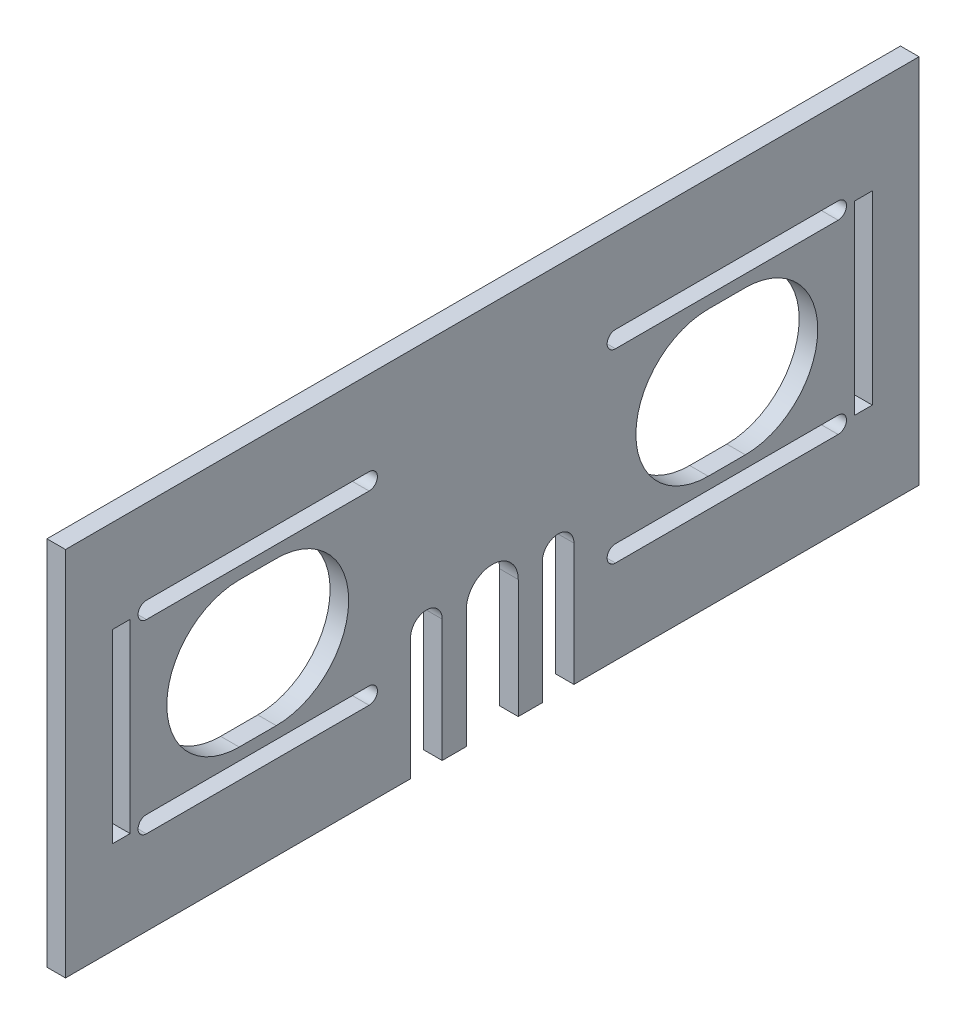
from build123d import *

# Parameters (mm, degrees)
CUT_EXTRUDE1_START     = -5
CUT_EXTRUDE1_OUTLINE_W = 4.8
CUT_EXTRUDE1_OUTLINE_H = 50
CUT_EXTRUDE1_DEPTH     = 5
BOSS_EXTRUDE1_START    = -5
BOSS_EXTRUDE1_DEPTH    = 5
BOSS_EXTRUDE2_START    = -5
BOSS_EXTRUDE2_DEPTH    = 5
CUT_EXTRUDE2_DEPTH     = 10
BOSS_EXTRUDE3_START    = -5
BOSS_EXTRUDE3_DEPTH    = 5
BOSS_EXTRUDE4_START    = -5
BOSS_EXTRUDE4_DEPTH    = 5


with BuildPart() as part:
    # Cut-Extrude1: read off the stored shape, not the designer's step
    # Cut-Extrude1 outline → Cut-Extrude1 (new body)
    with BuildSketch(Plane.ZY.offset(CUT_EXTRUDE1_START)):
        with BuildLine():
            Line((22, -25), (47, -50))
            Line((47, -50), (115, -50))
            Line((115, -50), (115, 50))
            Line((115, 50), (-115, 50))
            Line((-115, 50), (-115, -50))
            Line((-115, -50), (-47, -50))
            Line((-47, -50), (-22, -25))
            Line((-22, -25), (-22, 0))
            ThreePointArc((-22, 0), (-16.382917933, 14.683323874), (-2.4, 21.868699093))
            Line((-2.4, 21.868699093), (-2.4, 25))
            Line((-2.4, 25), (2.4, 25))
            Line((2.4, 25), (2.4, 21.868699093))
            ThreePointArc((2.4, 21.868699093), (16.382917933, 14.683323874), (22, 0))
            Line((22, 0), (22, -25))
        make_face()
        with BuildLine():
            ThreePointArc((-33.2, -22.75), (-30.95, -25), (-33.2, -27.25))
            Line((-33.2, -27.25), (-93.2, -27.25))
            ThreePointArc((-93.2, -27.25), (-95.45, -25), (-93.2, -22.75))
            Line((-93.2, -22.75), (-33.2, -22.75))
        make_face(mode=Mode.SUBTRACT)
        with BuildLine():
            ThreePointArc((33.2, -27.25), (30.95, -25), (33.2, -22.75))
            Line((33.2, -22.75), (93.2, -22.75))
            ThreePointArc((93.2, -22.75), (95.45, -25), (93.2, -27.25))
            Line((93.2, -27.25), (33.2, -27.25))
        make_face(mode=Mode.SUBTRACT)
        with Locations((-100, 0)):
            Rectangle(CUT_EXTRUDE1_OUTLINE_W, CUT_EXTRUDE1_OUTLINE_H, mode=Mode.SUBTRACT)
        with BuildLine():
            ThreePointArc((-58.2, 19.5), (-38.7, 0), (-58.2, -19.5))
            Line((-58.2, -19.5), (-68.2, -19.5))
            ThreePointArc((-68.2, -19.5), (-87.7, 0), (-68.2, 19.5))
            Line((-68.2, 19.5), (-58.2, 19.5))
        make_face(mode=Mode.SUBTRACT)
        with BuildLine():
            ThreePointArc((-33.2, 27.25), (-30.95, 25), (-33.2, 22.75))
            Line((-33.2, 22.75), (-93.2, 22.75))
            ThreePointArc((-93.2, 22.75), (-95.45, 25), (-93.2, 27.25))
            Line((-93.2, 27.25), (-33.2, 27.25))
        make_face(mode=Mode.SUBTRACT)
        with BuildLine():
            ThreePointArc((58.2, -19.5), (38.7, 0), (58.2, 19.5))
            Line((58.2, 19.5), (68.2, 19.5))
            ThreePointArc((68.2, 19.5), (87.7, 0), (68.2, -19.5))
            Line((68.2, -19.5), (58.2, -19.5))
        make_face(mode=Mode.SUBTRACT)
        with Locations((100, 0)):
            Rectangle(CUT_EXTRUDE1_OUTLINE_W, CUT_EXTRUDE1_OUTLINE_H, mode=Mode.SUBTRACT)
        with BuildLine():
            ThreePointArc((33.2, 22.75), (30.95, 25), (33.2, 27.25))
            Line((33.2, 27.25), (93.2, 27.25))
            ThreePointArc((93.2, 27.25), (95.45, 25), (93.2, 22.75))
            Line((93.2, 22.75), (33.2, 22.75))
        make_face(mode=Mode.SUBTRACT)
    extrude(amount=CUT_EXTRUDE1_DEPTH)

    # Sketch2 → Boss-Extrude1 (add)
    with BuildSketch(Plane.ZY.offset(BOSS_EXTRUDE1_START)):
        with BuildLine():
            Line((2.4, 25), (-2.4, 25))
            Line((-2.4, 25), (-2.4, 21.868699093))
            ThreePointArc((-2.4, 21.868699093), (0, 22), (2.4, 21.868699093))
            Line((2.4, 21.868699093), (2.4, 25))
        make_face()
    extrude(amount=BOSS_EXTRUDE1_DEPTH)

    # Sketch3 → Boss-Extrude2 (add)
    with BuildSketch(Plane.ZY.offset(BOSS_EXTRUDE2_START)):
        with BuildLine():
            Line((13.5, -50), (13.5, 17.370952766))
            ThreePointArc((13.5, 17.370952766), (0, 22), (-13.5, 17.370952766))
            Line((-13.5, 17.370952766), (-13.5, -50))
            Line((-13.5, -50), (13.5, -50))
        make_face()
    extrude(amount=BOSS_EXTRUDE2_DEPTH)

    # Sketch4 → Cut-Extrude2 (cut)
    with BuildSketch(Plane.ZY):
        with BuildLine():
            Line((7, -18), (7, -50))
            ThreePointArc((7, -50), (0, -57), (-7, -50))
            Line((-7, -50), (-7, -18))
            ThreePointArc((-7, -18), (0, -11), (7, -18))
        make_face()
    extrude(amount=-CUT_EXTRUDE2_DEPTH, mode=Mode.SUBTRACT)

    # Sketch5 → Boss-Extrude3 (add)
    with BuildSketch(Plane.ZY.offset(BOSS_EXTRUDE3_START)):
        Polygon((-22, -25), (-22, -50), (-47, -50), align=None)
        with BuildLine():
            Line((-13.5, 17.370952766), (-13.5, 0))
            ThreePointArc((-13.5, 0), (-17.75, 4.25), (-22, 0))
            ThreePointArc((-22, 0), (-19.761072845, 9.669539803), (-13.5, 17.370952766))
        make_face()
    boss_extrude3 = extrude(amount=BOSS_EXTRUDE3_DEPTH)

    # Sketch6 → Boss-Extrude4 (add)
    with BuildSketch(Plane.ZY.offset(BOSS_EXTRUDE4_START)):
        with BuildLine():
            Line((-13.5, 0), (-13.5, -17))
            ThreePointArc((-13.5, -17), (-17.75, -12.75), (-22, -17))
            Line((-22, -17), (-22, 0))
            ThreePointArc((-22, 0), (-17.75, 4.25), (-13.5, 0))
        make_face()
    boss_extrude4 = extrude(amount=BOSS_EXTRUDE4_DEPTH)

    # Mirror1: Boss-Extrude3, Boss-Extrude4 across plane
    add(boss_extrude3.mirror(Plane.XY))
    add(boss_extrude4.mirror(Plane.XY))


solid = part.part
